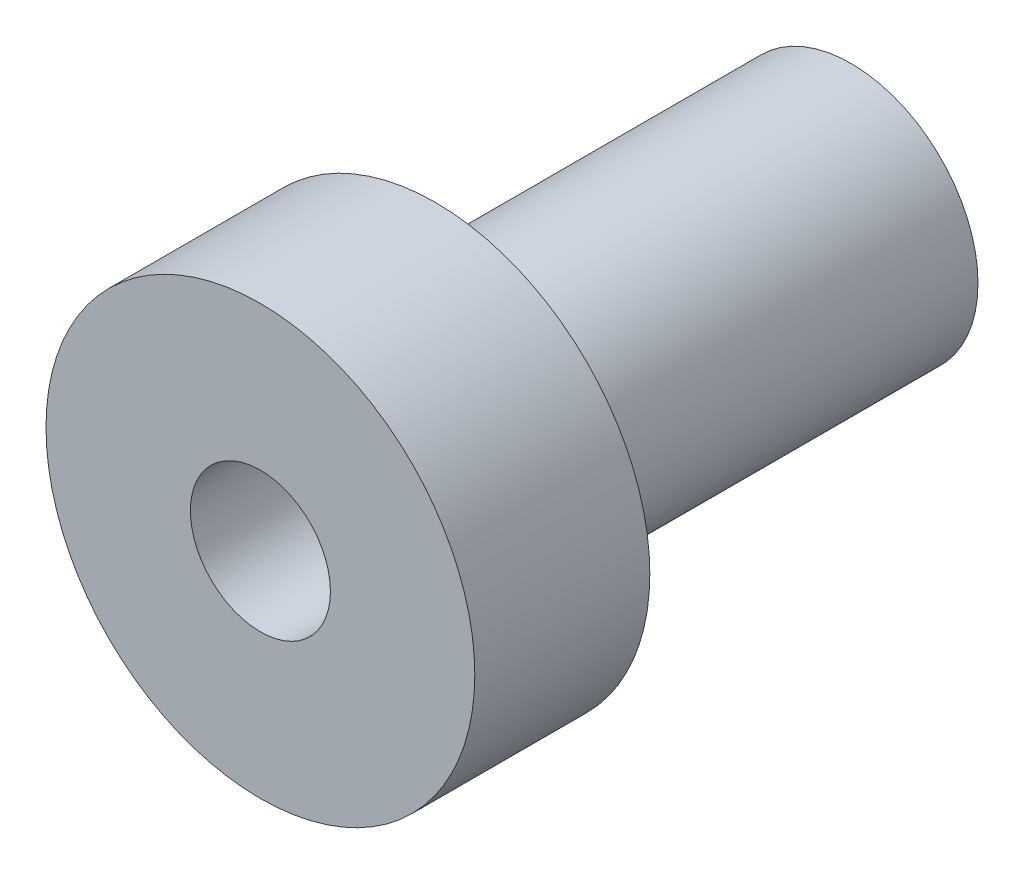
from build123d import *

# Parameters (mm, degrees)
SZKIC1_R                        = 2.9
DODANIE_WYCI_GNI_CIE1_DEPTH     = 9.5
WYTNIJ_WYCI_GNI_CIE1_DEPTH      = 11.347463457
WYTNIJ_WYCI_GNI_CIE1_DEPTH_BACK = 11.347463457
SZKIC2_R                        = 1.6
SZKIC3_R                        = 4.9
DODANIE_WYCI_GNI_CIE2_DEPTH     = 4
SZKIC4_R                        = 1.6
WYTNIJ_WYCI_GNI_CIE2_DEPTH      = 16.174649914


with BuildPart() as part:
    # Szkic1 → Dodanie-wyciągnięcie1 (new body)
    with BuildSketch(Plane.XY):
        Circle(SZKIC1_R)
    extrude(amount=DODANIE_WYCI_GNI_CIE1_DEPTH)

    # Szkic2 → Wytnij-wyciągnięcie1 (cut, two sides: drawn at the far end of the back side and taken through both)
    with BuildSketch(Plane.XY.offset(9.5).offset(-WYTNIJ_WYCI_GNI_CIE1_DEPTH_BACK)):
        Circle(SZKIC2_R)
    extrude(amount=WYTNIJ_WYCI_GNI_CIE1_DEPTH + WYTNIJ_WYCI_GNI_CIE1_DEPTH_BACK, mode=Mode.SUBTRACT)

    # Szkic3 → Dodanie-wyciągnięcie2 (add)
    with BuildSketch(Plane.XY.offset(9.5)):
        Circle(SZKIC3_R)
    extrude(amount=DODANIE_WYCI_GNI_CIE2_DEPTH)

    # Szkic4 → Wytnij-wyciągnięcie2 (cut, through all)
    with BuildSketch(Plane.XY):
        Circle(SZKIC4_R)
    extrude(amount=WYTNIJ_WYCI_GNI_CIE2_DEPTH, mode=Mode.SUBTRACT)


solid = part.part
